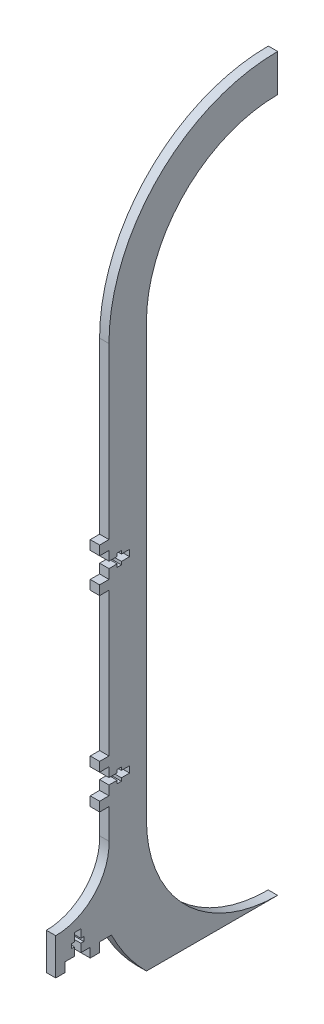
from build123d import *

# Parameters (mm, degrees)
BOSS_EXTRUDE2_DEPTH = 6.35


with BuildPart() as part:
    # Elevator Ball Support Rail → Boss-Extrude2 (new body)
    with BuildSketch(Plane(origin=(0, 0, 0), x_dir=(0, 0, -1), z_dir=(1, 0, 0))):
        with BuildLine():
            ThreePointArc((0, 146.05), (26.038207153, 208.911792847), (88.9, 234.95))
            Line((88.9, 234.95), (88.9, 260.35))
            ThreePointArc((88.9, 260.35), (8.07769491, 226.87230509), (-25.4, 146.05))
            Line((-25.4, 146.05), (-25.4, 30.988))
            Line((-25.4, 30.988), (-31.75, 30.988))
            Line((-31.75, 30.988), (-31.75, 24.638))
            Line((-31.75, 24.638), (-25.4, 24.638))
            Line((-25.4, 24.638), (-25.4, 18.288))
            Line((-25.4, 18.288), (-19.865000021, 18.288))
            Line((-19.865000021, 18.288), (-19.865000021, 20.328999982))
            Line((-19.865000021, 20.328999982), (-16.964999979, 20.328999982))
            Line((-16.964999979, 20.328999982), (-16.964999979, 18.288))
            Line((-16.964999979, 18.288), (-11.43, 18.288))
            Line((-11.43, 18.288), (-11.43, 13.97))
            Line((-11.43, 13.97), (-16.964999979, 13.97))
            Line((-16.964999979, 13.97), (-16.964999979, 11.929000018))
            Line((-16.964999979, 11.929000018), (-19.865000021, 11.929000018))
            Line((-19.865000021, 11.929000018), (-19.865000021, 13.97))
            Line((-19.865000021, 13.97), (-25.4, 13.97))
            Line((-25.4, 13.97), (-25.4, 7.62))
            Line((-25.4, 7.62), (-31.75, 7.62))
            Line((-31.75, 7.62), (-31.75, 1.27))
            Line((-31.75, 1.27), (-25.4, 1.27))
            Line((-25.4, 1.27), (-25.4, -96.012))
            Line((-25.4, -96.012), (-31.75, -96.012))
            Line((-31.75, -96.012), (-31.75, -102.362))
            Line((-31.75, -102.362), (-25.4, -102.362))
            Line((-25.4, -102.362), (-25.4, -108.712))
            Line((-25.4, -108.712), (-19.865000021, -108.712))
            Line((-19.865000021, -108.712), (-19.865000021, -106.671000018))
            Line((-19.865000021, -106.671000018), (-16.964999979, -106.671000018))
            Line((-16.964999979, -106.671000018), (-16.964999979, -108.712))
            Line((-16.964999979, -108.712), (-11.43, -108.712))
            Line((-11.43, -108.712), (-11.43, -113.03))
            Line((-11.43, -113.03), (-16.964999979, -113.03))
            Line((-16.964999979, -113.03), (-16.964999979, -115.070999982))
            Line((-16.964999979, -115.070999982), (-19.865000021, -115.070999982))
            Line((-19.865000021, -115.070999982), (-19.865000021, -113.03))
            Line((-19.865000021, -113.03), (-25.4, -113.03))
            Line((-25.4, -113.03), (-25.4, -119.38))
            Line((-25.4, -119.38), (-31.75, -119.38))
            Line((-31.75, -119.38), (-31.75, -125.73))
            Line((-31.75, -125.73), (-25.4, -125.73))
            Line((-25.4, -125.73), (-25.4, -146.05))
            ThreePointArc((-25.4, -146.05), (-35.489731343, -172.410628013), (-61.468, -183.447608823))
            Line((-61.468, -183.447608823), (-61.468, -201.93))
            Line((-61.468, -201.93), (-61.468, -208.28))
            Line((-61.468, -208.28), (-55.118, -208.28))
            Line((-55.118, -208.28), (-55.118, -201.93))
            Line((-55.118, -201.93), (-48.768, -201.93))
            Line((-48.768, -201.93), (-48.768, -196.395000021))
            Line((-48.768, -196.395000021), (-50.808999982, -196.395000021))
            Line((-50.808999982, -196.395000021), (-50.808999982, -193.494999979))
            Line((-50.808999982, -193.494999979), (-48.768, -193.494999979))
            Line((-48.768, -193.494999979), (-48.768, -187.96))
            Line((-48.768, -187.96), (-44.45, -187.96))
            Line((-44.45, -187.96), (-44.45, -193.494999979))
            Line((-44.45, -193.494999979), (-42.409000018, -193.494999979))
            Line((-42.409000018, -193.494999979), (-42.409000018, -196.395000021))
            Line((-42.409000018, -196.395000021), (-44.45, -196.395000021))
            Line((-44.45, -196.395000021), (-44.45, -201.93))
            Line((-44.45, -201.93), (-38.1, -201.93))
            Line((-38.1, -201.93), (-38.1, -208.28))
            Line((-38.1, -208.28), (-31.75, -208.28))
            Line((-31.75, -208.28), (-31.75, -201.93))
            Line((-31.75, -201.93), (-23.722580329, -201.93))
            ThreePointArc((-23.722580329, -201.93), (-13.204934727, -219.405315447), (0, -234.95))
            Line((0, -234.95), (88.9, -234.95))
            ThreePointArc((88.9, -234.95), (26.038207153, -208.911792847), (0, -146.05))
            Line((0, -146.05), (0, 146.05))
        make_face()
    extrude(amount=BOSS_EXTRUDE2_DEPTH)


solid = part.part
